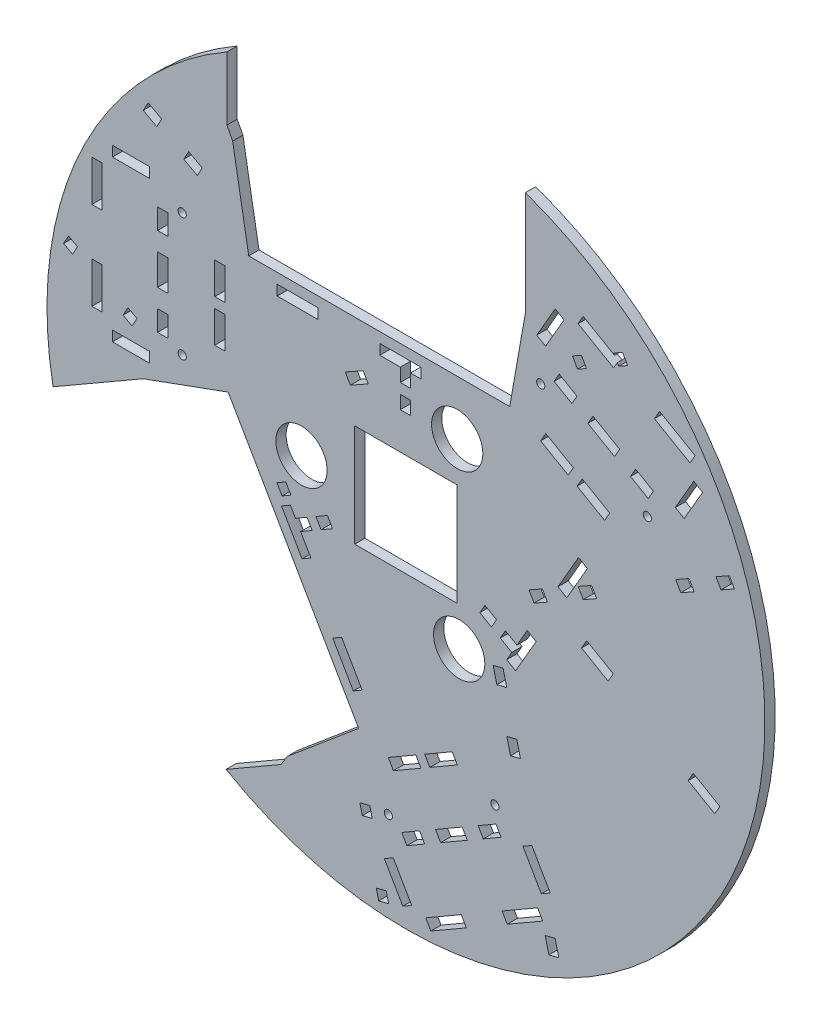
from build123d import *

# Parameters (mm, degrees)
ESQUISSE1_R                   = 175
BOSS_EXTRU_1_DEPTH            = 5
ESQUISSE2_W                   = 18
ESQUISSE2_H                   = 5
ESQUISSE2_W_2                 = 5
ESQUISSE2_H_2                 = 20
ESQUISSE2_H_3                 = 10
ESQUISSE2_H_4                 = 15
ESQUISSE2_H_5                 = 15.5
ESQUISSE2_W_3                 = 20
ESQUISSE2_H_6                 = 6.5
ENL_V_MAT_EXTRU_1_DEPTH       = 5
ESQUISSE6_R                   = 12.5
ESQUISSE6_W                   = 50
ESQUISSE6_H                   = 50
ENL_V_MAT_EXTRU_6_DEPTH       = 5
TROUS_DE_CENTRAGE_4_0MM1_D    = 4
HOLES_CATCHERS_OF_GLASS_DEPTH = 10
HOLES_BOARDS_SERVO_DEPTH      = 10


with BuildPart() as part:
    # Esquisse1 → Boss.-Extru.1 (new body)
    with BuildSketch(Plane.XY):
        with Locations((148.080426897, -12.110171348)):
            Circle(ESQUISSE1_R)
    extrude(amount=BOSS_EXTRU_1_DEPTH)

    # Esquisse2 → Enlèv. mat.-Extru.1 (cut)
    with BuildSketch(Plane.XY.offset(5)):
        Polygon((135.311788567, 53.777441362), (135.311788567, 48.777441362), (145.311788567, 48.777441362), (145.311788567, 42.277441362), (150.311788567, 42.277441362), (150.311788567, 48.777441362), (155.311788567, 48.777441362), (155.311788567, 53.777441362), align=None)
        with Locations((14, 69.777441362)):
            Rectangle(ESQUISSE2_W, ESQUISSE2_H)
        with Locations((-2.5, 52.277441362)):
            Rectangle(ESQUISSE2_W_2, ESQUISSE2_H_2)
        with Locations((-2.5, 9.277441362)):
            Rectangle(ESQUISSE2_W_2, ESQUISSE2_H_2)
        with Locations((14, -8.222558638)):
            Rectangle(ESQUISSE2_W, ESQUISSE2_H)
        with Locations((29.5, 9.277441362)):
            Rectangle(ESQUISSE2_W_2, ESQUISSE2_H_3)
        with Locations((29.5, 30.777441362)):
            Rectangle(ESQUISSE2_W_2, ESQUISSE2_H_4)
        with Locations((29.5, 52.277441362)):
            Rectangle(ESQUISSE2_W_2, ESQUISSE2_H_3)
        with Locations((57.36, 41.027441362)):
            Rectangle(ESQUISSE2_W_2, ESQUISSE2_H_5)
        with Locations((57.36, 20.527441362)):
            Rectangle(ESQUISSE2_W_2, ESQUISSE2_H_5)
        with Locations((95.311788567, 51.277441362)):
            Rectangle(ESQUISSE2_W_3, ESQUISSE2_H)
        with Locations((147.811788567, 34.027441362)):
            Rectangle(ESQUISSE2_W_2, ESQUISSE2_H_6)
        Polygon((292.702456717, 69.607306773), (283.702456717, 54.018849505), (279.372329698, 56.518849505), (288.372329698, 72.107306773), align=None)
        Polygon((289.042202679, 83.267560811), (286.542202679, 78.937433792), (269.221694603, 88.937433792), (271.721694603, 93.267560811), align=None)
        Polygon((251.803110316, 104.767560811), (249.303110316, 100.437433792), (231.982602241, 110.437433792), (234.482602241, 114.767560811), align=None)
        Polygon((225.152475222, 108.607306773), (216.152475222, 93.018849505), (211.822348203, 95.518849505), (220.822348203, 111.107306773), align=None)
        Polygon((231.472983297, 79.55474789), (228.972983297, 75.224620871), (220.31272926, 80.224620871), (222.81272926, 84.55474789), align=None)
        Polygon((252.257592988, 67.55474789), (249.757592988, 63.224620871), (236.767211932, 70.724620871), (239.267211932, 75.05474789), align=None)
        Polygon((268.71207566, 58.05474789), (266.21207566, 53.724620871), (257.551821622, 58.724620871), (260.051821622, 63.05474789), align=None)
        Polygon((247.420859728, 38.17728014), (244.920859728, 33.847153121), (231.497465969, 41.597153121), (233.997465969, 45.92728014), align=None)
        Polygon((229.66733895, 48.42728014), (227.16733895, 44.097153121), (213.743945192, 51.847153121), (216.243945192, 56.17728014), align=None)
        Polygon((211.525092463, -33.996012539), (207.194965444, -31.496012539), (202.194965444, -40.156266577), (196.56580032, -36.906266577), (194.06580032, -41.236393596), (199.694965444, -44.486393596), (197.194965444, -48.816520615), (201.525092463, -51.316520615), align=None)
        Polygon((236.525092463, 9.30525765), (226.525092463, -8.015250425), (222.194965444, -5.515250425), (232.194965444, 11.80525765), align=None)
        Polygon((192.235673301, -34.406266577), (189.735673301, -38.736393596), (184.106508176, -35.486393596), (186.606508176, -31.156266577), align=None)
        Polygon((146.538823973, -178.215262181), (137.538823973, -162.626804912), (141.868950992, -160.126804912), (150.868950992, -175.715262181), align=None)
        Polygon((160.199078011, -181.875516218), (157.699078011, -177.545389199), (175.019586086, -167.545389199), (177.519586086, -171.875516218), align=None)
        Polygon((197.438170373, -160.375516218), (194.938170373, -156.045389199), (212.258678449, -146.045389199), (214.758678449, -150.375516218), align=None)
        Polygon((214.088805468, -139.215262181), (205.088805468, -123.626804912), (209.418932487, -121.126804912), (218.418932487, -136.715262181), align=None)
        Polygon((185.768297392, -130.162703297), (183.268297392, -125.832576278), (191.92855143, -120.832576278), (194.42855143, -125.162703297), align=None)
        Polygon((164.983687701, -142.162703297), (162.483687701, -137.832576278), (175.474068758, -130.332576278), (177.974068758, -134.662703297), align=None)
        Polygon((148.52920503, -151.662703297), (146.02920503, -147.332576278), (154.689459067, -142.332576278), (157.189459067, -146.662703297), align=None)
        Polygon((141.960420962, -123.285235548), (139.460420962, -118.955108529), (152.88381472, -111.205108529), (155.38381472, -115.535235548), align=None)
        Polygon((159.713941739, -113.035235548), (157.213941739, -108.705108529), (170.637335498, -100.955108529), (173.137335498, -105.285235548), align=None)
        Polygon((97.404399659, -56.111942869), (101.734526678, -53.611942869), (96.734526678, -44.951688831), (102.363691803, -41.701688831), (99.863691803, -37.371561812), (94.234526678, -40.621561812), (91.734526678, -36.291434793), (87.404399659, -38.791434793), align=None)
        Polygon((122.404399659, -99.413213058), (112.404399659, -82.092704982), (116.734526678, -79.592704982), (126.734526678, -96.913213058), align=None)
        Polygon((106.693818822, -39.201688831), (104.193818822, -34.871561812), (109.822983946, -31.621561812), (112.322983946, -35.951688831), align=None)
    extrude(amount=-ENL_V_MAT_EXTRU_1_DEPTH, mode=Mode.SUBTRACT)

    # Esquisse6 → Enlèv. mat.-Extru.6 (cut)
    with BuildSketch(Plane.XY.offset(5)):
        with Locations((173.06, 32.277441362)):
            Circle(ESQUISSE6_R)
        with Locations((174.031440566, -55.936922587)):
            Circle(ESQUISSE6_R)
        with Locations((97.149840124, -12.67103282)):
            Circle(ESQUISSE6_R)
        Polygon((206.321253746, 102.221853729), (206.321253746, 185.563712918), (60.797190046, 185.563712918), (60.797190046, 108.682370842), (63.584787187, 103.348250546), (71.443823398, 58.777441362), (198.660831685, 58.777441362), align=None)
        with Locations((148.080426897, -12.110171348)):
            Rectangle(ESQUISSE6_W, ESQUISSE6_H)
        Polygon((19.945575289, -18.838148298), (-52.230591968, -60.509077893), (20.531439882, -186.536613919), (87.112635197, -148.095942881), (90.338320311, -143.014752793), (125.008255225, -113.923223194), (61.399751081, -3.750062223), align=None)
        Polygon((236.171367804, -21.307411432), (249.16174886, -28.807411432), (246.66174886, -33.137538451), (233.671367804, -25.637538451), align=None)
        Polygon((288.132892031, -51.307411432), (301.123273088, -58.807411432), (298.623273088, -63.137538451), (285.632892031, -55.637538451), align=None)
    extrude(amount=-ENL_V_MAT_EXTRU_6_DEPTH, mode=Mode.SUBTRACT)

    # Trous de centrage Ø4.0mm1 (through all)
    with Locations(Plane(origin=(148.080426897, -12.110171348, -78), x_dir=(1, 0, 0), z_dir=(0, 0, -1))):
        with Locations((65.70121345, -88.022614393), (117.662737677, -58.022614393), (-109.080426897, -72.887612711), (-109.080426897, -12.887612711), (-8.58231078, 130.910227103), (43.379213447, 100.910227103)):
            Hole(TROUS_DE_CENTRAGE_4_0MM1_D / 2)

    # Esquisse9 → Holes catchers of glass (cut)
    with BuildSketch(Plane.XY.offset(5)):
        Polygon((301.647255965, 32.874727734), (299.200467122, 37.235143352), (305.741090548, 40.905326617), (308.187879391, 36.544910999), align=None)
        Polygon((282.025385687, 21.864177939), (279.578596844, 26.224593557), (286.11922027, 29.894776822), (288.566009113, 25.534361204), align=None)
        Polygon((241.037478884, -1.135637188), (238.590690041, 3.22477843), (232.050066614, -0.445404835), (234.496855458, -4.805820453), align=None)
        Polygon((214.608404145, -10.232560209), (217.055192988, -14.592975826), (210.514569562, -18.263159091), (208.067780719, -13.902743474), align=None)
        Polygon((256.127471573, 104.799683271), (251.767055956, 102.352894427), (249.320267112, 106.713310045), (253.68068273, 109.160098888), align=None)
        Polygon((236.069559733, 93.544454591), (231.709144116, 91.097665748), (229.262355272, 95.458081365), (233.62277089, 97.904870209), align=None)
        Polygon((129.675418669, 33.842806815), (120.954587434, 28.949229128), (118.507798591, 33.309644745), (127.228629826, 38.203222432), align=None)
        Polygon((-16.43844555, 23.279140051), (-12.045948181, 20.890423478), (-14.434664754, 16.49792611), (-18.827162123, 18.886642683), align=None)
        Polygon((12.552037084, 7.51361067), (16.944534453, 5.124894098), (14.55581788, 0.732396729), (10.163320511, 3.121113302), align=None)
        Polygon((22.412737241, 98.907081949), (29.001483294, 95.32400709), (26.612766722, 90.931509721), (20.024020668, 94.514584581), align=None)
        Polygon((42.178975401, 88.157857372), (48.767721454, 84.574782512), (46.379004881, 80.182285143), (39.790258828, 83.765360003), align=None)
        Polygon((126.799616111, -149.834276272), (125.585690653, -144.983875775), (130.43609115, -143.769950316), (131.650016608, -148.620350813), align=None)
        Polygon((134.811524138, -181.846919552), (133.597598679, -176.996519055), (138.447999176, -175.782593596), (139.661924635, -180.632994093), align=None)
        Polygon((190.561972498, -54.501375823), (195.412372995, -53.287450364), (197.233261183, -60.56305111), (192.382860686, -61.776976568), align=None)
        Polygon((202.088963017, -79.964653097), (197.23856252, -81.178578556), (199.059450708, -88.454179302), (203.909851205, -87.240253843), align=None)
        Polygon((222.604303267, -161.936421496), (217.75390277, -163.150346955), (215.933014582, -155.874746209), (220.783415079, -154.660820751), align=None)
    extrude(amount=-HOLES_CATCHERS_OF_GLASS_DEPTH, mode=Mode.SUBTRACT)

    # Esquisse10 → Holes boards servo (cut)
    with BuildSketch(Plane.XY.offset(5)):
        Polygon((89.496120404, -27.614401399), (91.996120404, -31.944528418), (87.66720686, -34.443827818), (85.16720686, -30.113700799), align=None)
    extrude(amount=-HOLES_BOARDS_SERVO_DEPTH, mode=Mode.SUBTRACT)


solid = part.part
